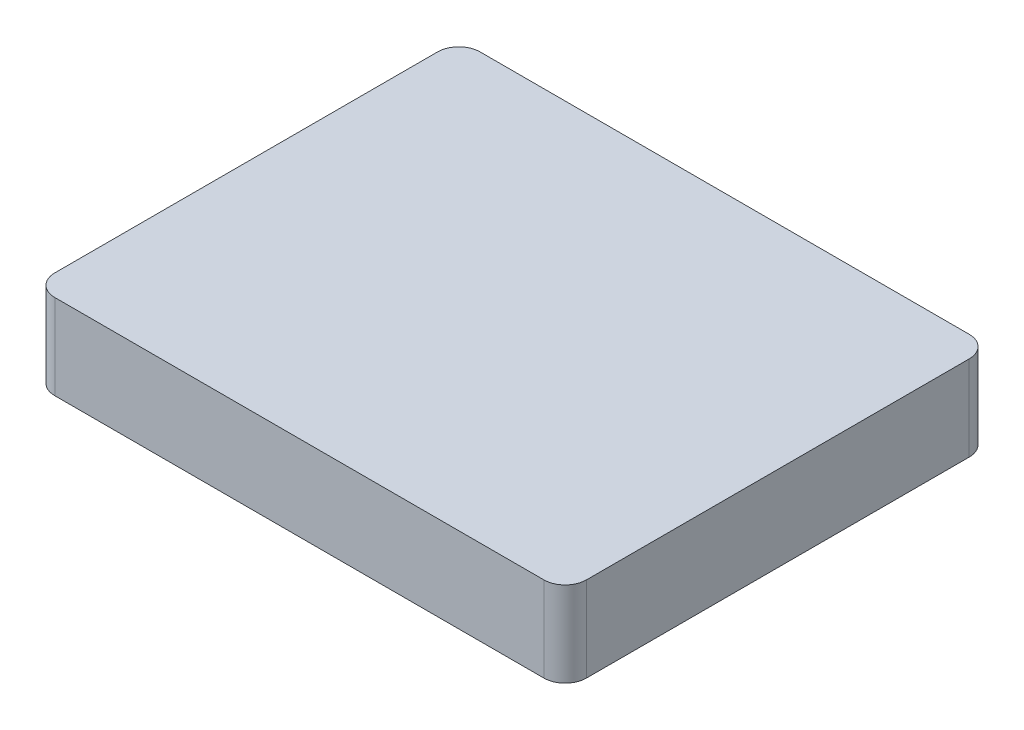
from build123d import *

# Parameters (mm, degrees)
SKETCH1_W           = 15.875
SKETCH1_H           = 12.7
BOSS_EXTRUDE1_DEPTH = 2.54
FILLET1_R           = 0.635
SHELL1_START        = 0.635
SHELL1_OUTLINE_W    = 1.905
SHELL1_OUTLINE_H    = 11.43
SHELL1_DEPTH        = 14.605
SKETCH2_R           = 2.54
BOSS_EXTRUDE2_DEPTH = 1.905


# Read off the part's stored shape, not the designer's step: Shell1
with BuildPart() as part:
    # Sketch1 → Boss-Extrude1 (new body)
    with BuildSketch(Plane(origin=(0, 0, 0), x_dir=(1, 0, 0), z_dir=(0, 1, 0))):
        with Locations((7.9375, 6.35)):
            Rectangle(SKETCH1_W, SKETCH1_H)
    extrude(amount=BOSS_EXTRUDE1_DEPTH)

    # Fillet1
    fillet1_edges = [part.edges().sort_by_distance(p)[0] for p in [
        (0, 1.27, -12.7),
        (15.875, 1.27, -12.7),
        (15.875, 1.27, 0),
        (0, 1.27, 0),
    ]]
    fillet(fillet1_edges, radius=FILLET1_R)

    # Shell1 outline → Shell1 (cut)
    with BuildSketch(Plane.YZ.offset(SHELL1_START)):
        with Locations((0.9525, -6.35)):
            Rectangle(SHELL1_OUTLINE_W, SHELL1_OUTLINE_H)
    extrude(amount=SHELL1_DEPTH, mode=Mode.SUBTRACT)

    # Sketch2 → Boss-Extrude2 (add)
    with BuildSketch(Plane(origin=(0, 1.905, 0), x_dir=(-1, 0, 0), z_dir=(0, -1, 0))):
        with Locations(Location((-7.9375, 6.35, 0), (0, 0, 270))):
            Circle(SKETCH2_R)
    extrude(amount=BOSS_EXTRUDE2_DEPTH)


solid = part.part
